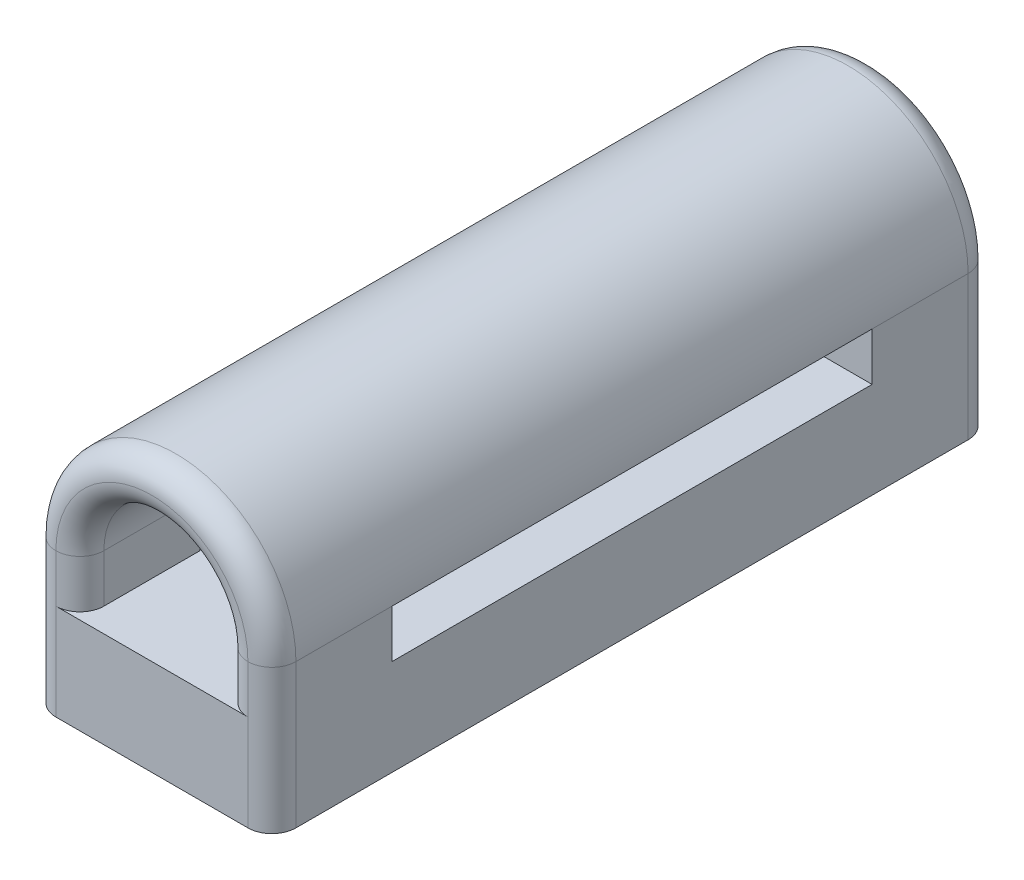
from build123d import *

# Parameters (mm, degrees)
DODANIE_WYCI_GNI_CIE2_DEPTH = 15
SZKIC3_W                    = 1
SZKIC3_H                    = 2.5
DODANIE_WYCI_GNI_CIE3_DEPTH = 3
SZKIC4_W                    = 1
SZKIC4_H                    = 2
DODANIE_WYCI_GNI_CIE4_DEPTH = 10
SZKIC6_W                    = 15
SZKIC6_H                    = 2
DODANIE_WYCI_GNI_CIE5_DEPTH = 3
ZAOKR_GLENIE1_R             = 0.5


with BuildPart() as part:
    # Szkic1 → Dodanie-wyciągnięcie2 (new body)
    with BuildSketch(Plane.XY):
        with BuildLine():
            ThreePointArc((-2.5, 0), (0, 2.5), (2.5, 0))
            Line((2.5, 0), (1.5, 0))
            ThreePointArc((1.5, 0), (0, 1.5), (-1.5, 0))
            Line((-1.5, 0), (-2.5, 0))
        make_face()
    extrude(amount=DODANIE_WYCI_GNI_CIE2_DEPTH)

    # Szkic3 → Dodanie-wyciągnięcie3 (add)
    with BuildSketch(Plane.XZ):
        with Locations((-2, 13.75)):
            Rectangle(SZKIC3_W, SZKIC3_H)
        with Locations((2, 13.75)):
            Rectangle(SZKIC3_W, SZKIC3_H)
        with Locations((2, 1.25)):
            Rectangle(SZKIC3_W, SZKIC3_H)
        with Locations((-2, 1.25)):
            Rectangle(SZKIC3_W, SZKIC3_H)
    extrude(amount=DODANIE_WYCI_GNI_CIE3_DEPTH)

    # Szkic4 → Dodanie-wyciągnięcie4 (add)
    with BuildSketch(Plane(origin=(0, 0, 12.5), x_dir=(-1, 0, 0), z_dir=(0, 0, -1))):
        with Locations((2, -2)):
            Rectangle(SZKIC4_W, SZKIC4_H)
        with Locations((-2, -2)):
            Rectangle(SZKIC4_W, SZKIC4_H)
    extrude(amount=DODANIE_WYCI_GNI_CIE4_DEPTH)

    # Szkic6 → Dodanie-wyciągnięcie5 (add)
    with BuildSketch(Plane(origin=(-1.5, 0, 0), x_dir=(0, 0, -1), z_dir=(1, 0, 0))):
        with Locations((-7.5, -2)):
            Rectangle(SZKIC6_W, SZKIC6_H)
    extrude(amount=DODANIE_WYCI_GNI_CIE5_DEPTH)

    # Zaokrąglenie1
    zaokr_glenie1_edges = [part.edges().sort_by_distance(p)[0] for p in [
        (0, 1.5, 15),
        (-2.5, -1.5, 15),
        (2.5, -1.5, 15),
        (2.5, -1.5, 0),
        (-2.5, -1.5, 0),
        (0, 2.5, 15),
        (0, 1.5, 0),
        (0, 2.5, 0),
        (1.5, -0.5, 0),
        (1.5, -0.5, 15),
        (-1.5, -0.5, 15),
        (-1.5, -0.5, 0),
    ]]
    fillet(zaokr_glenie1_edges, radius=ZAOKR_GLENIE1_R - 0.0001)  # a hair under: the kernel refuses the full size


solid = part.part
